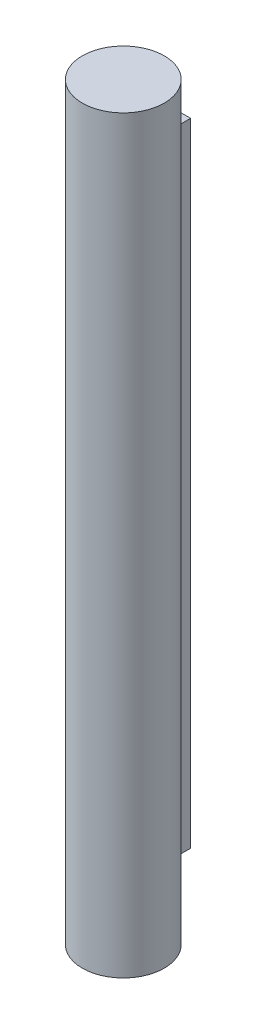
from build123d import *

# Parameters (mm, degrees)
BOSS_EXTRUDE2_DEPTH = 101.6
BOSS_EXTRUDE3_DEPTH = 85.725
MOVE_FACE2_DEPTH    = 7.9375
MOVE_START          = 85.725
MOVE_FACE2_2_DEPTH  = 7.9375


# Read off the part's stored shape, not the designer's step: Move Face2
with BuildPart() as part:
    # Sketch2 → Boss-Extrude2 (new body)
    with BuildSketch(Plane(origin=(0, 0, 0), x_dir=(1, 0, 0), z_dir=(0, 1, 0))):
        with BuildLine():
            Line((-1.190625, -5.427184), (-1.190625, 5.427184))
            ThreePointArc((-1.190625, 5.427184), (-5.55625, 0), (-1.190625, -5.427184))
        make_face()
        with BuildLine():
            ThreePointArc((1.190625, 5.427184), (0, 5.55625), (-1.190625, 5.427184))
            Line((-1.190625, 5.427184), (-1.190625, -5.427184))
            ThreePointArc((-1.190625, -5.427184), (0, -5.55625), (1.190625, -5.427184))
            Line((1.190625, -5.427184), (1.190625, 5.427184))
        make_face()
        with BuildLine():
            ThreePointArc((5.55625, 0), (4.32939512, 3.482563991), (1.190625, 5.427184))
            Line((1.190625, 5.427184), (1.190625, -5.427184))
            ThreePointArc((1.190625, -5.427184), (4.32939512, -3.482563991), (5.55625, 0))
        make_face()
    extrude(amount=BOSS_EXTRUDE2_DEPTH)


with BuildPart() as body_2:
    # Sketch2<6> → Boss-Extrude3 (new body)
    with BuildSketch(Plane(origin=(0, 0, 0), x_dir=(1, 0, 0), z_dir=(0, 1, 0))):
        with BuildLine():
            Line((1.190625, 7.9375), (-1.190625, 7.9375))
            Line((-1.190625, 7.9375), (-1.190625, 5.427184))
            ThreePointArc((-1.190625, 5.427184), (0, 5.55625), (1.190625, 5.427184))
            Line((1.190625, 5.427184), (1.190625, 7.9375))
        make_face()
    extrude(amount=BOSS_EXTRUDE3_DEPTH)

    # Move Face2 outline → Move Face2 (cut)
    with BuildSketch(Plane(origin=(0, 0, 0), x_dir=(1, 0, 0), z_dir=(0, 1, 0))):
        with BuildLine():
            Line((-1.190625, 7.9375), (-1.190625, 5.427184))
            ThreePointArc((-1.190625, 5.427184), (0, 5.55625), (1.190625, 5.427184))
            Line((1.190625, 5.427184), (1.190625, 7.9375))
            Line((1.190625, 7.9375), (-1.190625, 7.9375))
        make_face()
    extrude(amount=MOVE_FACE2_DEPTH, mode=Mode.SUBTRACT)

    # Move Face2 2 outline → Move Face2 2 (add)
    with BuildSketch(Plane(origin=(0, 0, 0), x_dir=(1, 0, 0), z_dir=(0, 1, 0)).offset(MOVE_START)):
        with BuildLine():
            Line((-1.190625, 7.9375), (-1.190625, 5.427184))
            ThreePointArc((-1.190625, 5.427184), (0, 5.55625), (1.190625, 5.427184))
            Line((1.190625, 5.427184), (1.190625, 7.9375))
            Line((1.190625, 7.9375), (-1.190625, 7.9375))
        make_face()
    extrude(amount=MOVE_FACE2_2_DEPTH)


solid = Compound([part.part, body_2.part])
